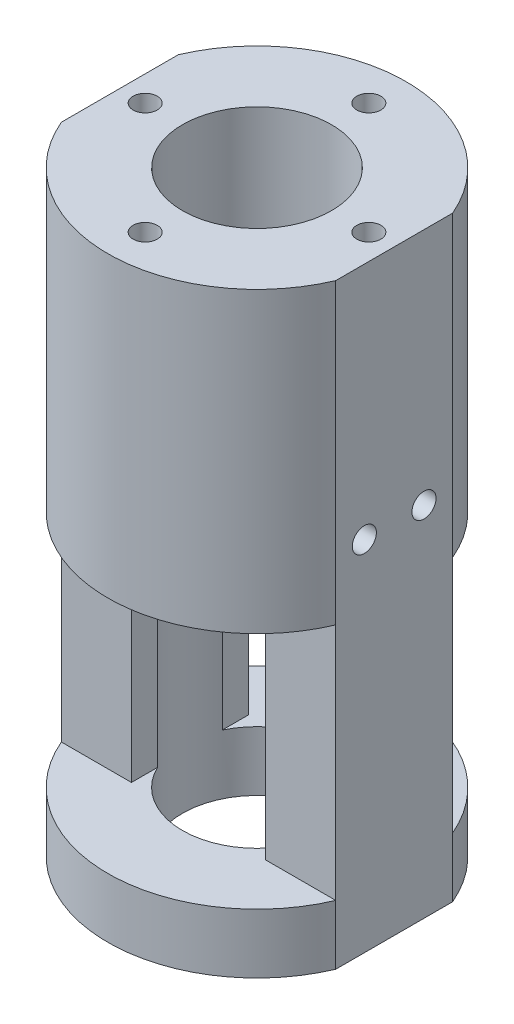
from build123d import *

# Parameters (mm, degrees)
SKETCH1_R                            = 25
BOSS_EXTRUDE1_DEPTH                  = 100
SKETCH7_R                            = 12.5
THRU_HOLE_DEPTH                      = 107.066017178
SKETCH5_W                            = 5
SKETCH5_H                            = 25
MOUNT_FLATS_DEPTH                    = 107.066017178
F_10_32_TAPPED_HOLE3_D               = 4.0386
F_10_32_TAPPED_HOLE3_DEPTH           = 30
F_10_32_TAPPED_HOLE3_TIP             = 1.213317848
SKETCH6_W                            = 20
SKETCH6_H                            = 40
WINDOW_SLOT_1_DEPTH                  = 106.61249926
WINDOW_SLOT_2_DEPTH                  = 106.61249926
WINDOW_SLOT_2_DEPTH_BACK             = 106.61249926
SKETCH18_W                           = 22.5
SKETCH18_H                           = 40
F_10_32_TAPPED_HOLE2_D               = 4.0386
F_10_32_TAPPED_HOLE2_DEPTH           = 9
F_10_32_TAPPED_HOLE2_TIP             = 1.213317848
F_10_32_TAPPED_HOLE2_ON_FACE_2_D     = 4.0386
F_10_32_TAPPED_HOLE2_ON_FACE_2_DEPTH = 9
F_10_32_TAPPED_HOLE2_ON_FACE_2_TIP   = 1.213317848
SKETCH22_R                           = 2.5273
SKETCH22_R_2                         = 12.5
BOSS_EXTRUDE2_DEPTH                  = 6.35
SAVE_START                           = 100
SAVE_BODIES2_OUTLINE_R               = 2.5273
SAVE_BODIES2_OUTLINE_R_2             = 12.5
SAVE_BODIES2_DEPTH                   = 6.35


# Read off the part's stored shape, not the designer's step: Save Bodies2
with BuildPart() as part:
    # Sketch1 → Boss-Extrude1 (new body)
    with BuildSketch(Plane(origin=(0, 0, 0), x_dir=(1, 0, 0), z_dir=(0, 1, 0))):
        with Locations(Location((0, 0, 0), (0, 0, 270))):
            Circle(SKETCH1_R)
    extrude(amount=BOSS_EXTRUDE1_DEPTH)

    # Sketch7 → Thru Hole (cut, through all)
    with BuildSketch(Plane(origin=(0, 0, 0), x_dir=(1, 0, 0), z_dir=(0, 1, 0))):
        with Locations(Location((0, 0, 0), (0, 0, 270))):
            Circle(SKETCH7_R)
    extrude(amount=THRU_HOLE_DEPTH, mode=Mode.SUBTRACT)

    # Sketch5 → Mount Flats (cut, through all)
    with BuildSketch(Plane(origin=(0, 0, 0), x_dir=(1, 0, 0), z_dir=(0, 1, 0))):
        with Locations((-25.5, 0)):
            Rectangle(SKETCH5_W, SKETCH5_H)
        with Locations((25.5, 0)):
            Rectangle(SKETCH5_W, SKETCH5_H)
    extrude(amount=MOUNT_FLATS_DEPTH, mode=Mode.SUBTRACT)

    # #10-32 Tapped Hole3
    with Locations(Plane(origin=(0, 100, 0), x_dir=(1, 0, 0), z_dir=(0, 1, 0))):
        with Locations((0, 18.75), (-18.75, 0), (0, -18.75), (18.75, 0)):
            Hole(F_10_32_TAPPED_HOLE3_D / 2, depth=F_10_32_TAPPED_HOLE3_DEPTH)
            with Locations((0, 0, -(F_10_32_TAPPED_HOLE3_DEPTH + F_10_32_TAPPED_HOLE3_TIP / 2))):  # 118° drill point
                Cone(0, F_10_32_TAPPED_HOLE3_D / 2, F_10_32_TAPPED_HOLE3_TIP, mode=Mode.SUBTRACT)

    # Sketch6 → Window Slot 1 (cut, symmetric)
    with BuildSketch(Plane(origin=(0, 0, 0), x_dir=(0, 0, -1), z_dir=(1, 0, 0))):
        with Locations((19.797958971, 30)):
            Rectangle(SKETCH6_W, SKETCH6_H)
    window_slot_1 = extrude(amount=WINDOW_SLOT_1_DEPTH, both=True, mode=Mode.SUBTRACT)

    # Mirror2: Window Slot 1 across plane
    add(window_slot_1.mirror(Plane.XY), mode=Mode.SUBTRACT)

    # Sketch18 → Window Slot 2 (cut, two sides: drawn at the far end of the back side and taken through both)
    with BuildSketch(Plane.XY.offset(-WINDOW_SLOT_2_DEPTH_BACK)):
        with Locations((0, 30)):
            Rectangle(SKETCH18_W, SKETCH18_H)
    extrude(amount=WINDOW_SLOT_2_DEPTH + WINDOW_SLOT_2_DEPTH_BACK, mode=Mode.SUBTRACT)

    # #10-32 Tapped Hole2
    with Locations(Plane(origin=(-23, 60, 5), x_dir=(0, 0, -1), z_dir=(-1, 0, 0))):
        with Locations((0, 0), (10, 0)):
            Hole(F_10_32_TAPPED_HOLE2_D / 2, depth=F_10_32_TAPPED_HOLE2_DEPTH)
            with Locations((0, 0, -(F_10_32_TAPPED_HOLE2_DEPTH + F_10_32_TAPPED_HOLE2_TIP / 2))):  # 118° drill point
                Cone(0, F_10_32_TAPPED_HOLE2_D / 2, F_10_32_TAPPED_HOLE2_TIP, mode=Mode.SUBTRACT)

    # #10-32 Tapped Hole2 on face 2
    with Locations(Plane(origin=(23, 60, 5), x_dir=(0, 0, 1), z_dir=(1, 0, 0))):
        with Locations((0, 0), (-10, 0)):
            Hole(F_10_32_TAPPED_HOLE2_ON_FACE_2_D / 2, depth=F_10_32_TAPPED_HOLE2_ON_FACE_2_DEPTH)
            with Locations((0, 0, -(F_10_32_TAPPED_HOLE2_ON_FACE_2_DEPTH + F_10_32_TAPPED_HOLE2_ON_FACE_2_TIP / 2))):  # 118° drill point
                Cone(0, F_10_32_TAPPED_HOLE2_ON_FACE_2_D / 2, F_10_32_TAPPED_HOLE2_ON_FACE_2_TIP, mode=Mode.SUBTRACT)


with BuildPart() as body_2:
    # Sketch22 → Boss-Extrude2 (new body)
    with BuildSketch(Plane(origin=(0, 100, 0), x_dir=(1, 0, 0), z_dir=(0, 1, 0))):
        with BuildLine():
            Line((23, -9.797958971), (23, 9.797958971))
            ThreePointArc((23, 9.797958971), (0, 25), (-23, 9.797958971))
            Line((-23, 9.797958971), (-23, -9.797958971))
            ThreePointArc((-23, -9.797958971), (0, -25), (23, -9.797958971))
        make_face()
        with Locations(Location((-18.75, 0, 0), (0, 0, 270))):
            Circle(SKETCH22_R, mode=Mode.SUBTRACT)
        with Locations(Location((0, 18.75, 0), (0, 0, 270))):
            Circle(SKETCH22_R, mode=Mode.SUBTRACT)
        with Locations(Location((18.75, 0, 0), (0, 0, 270))):
            Circle(SKETCH22_R, mode=Mode.SUBTRACT)
        with Locations(Location((0, -18.75, 0), (0, 0, 270))):
            Circle(SKETCH22_R, mode=Mode.SUBTRACT)
        with Locations(Location((0, 0, 0), (0, 0, 270))):
            Circle(SKETCH22_R_2, mode=Mode.SUBTRACT)
    extrude(amount=BOSS_EXTRUDE2_DEPTH)

    # Save Bodies2 outline → Save Bodies2 (cut)
    with BuildSketch(Plane(origin=(0, 0, 0), x_dir=(1, 0, 0), z_dir=(0, 1, 0)).offset(SAVE_START)):
        with BuildLine():
            ThreePointArc((-23, -9.797958971), (0, -25), (23, -9.797958971))
            Line((23, -9.797958971), (23, 9.797958971))
            ThreePointArc((23, 9.797958971), (0, 25), (-23, 9.797958971))
            Line((-23, 9.797958971), (-23, -9.797958971))
        make_face()
        with Locations((0, -18.75)):
            Circle(SAVE_BODIES2_OUTLINE_R, mode=Mode.SUBTRACT)
        with Locations((-18.75, 0)):
            Circle(SAVE_BODIES2_OUTLINE_R, mode=Mode.SUBTRACT)
        Circle(SAVE_BODIES2_OUTLINE_R_2, mode=Mode.SUBTRACT)
        with Locations((18.75, 0)):
            Circle(SAVE_BODIES2_OUTLINE_R, mode=Mode.SUBTRACT)
        with Locations((0, 18.75)):
            Circle(SAVE_BODIES2_OUTLINE_R, mode=Mode.SUBTRACT)
    extrude(amount=SAVE_BODIES2_DEPTH, mode=Mode.SUBTRACT)


solid = part.part
